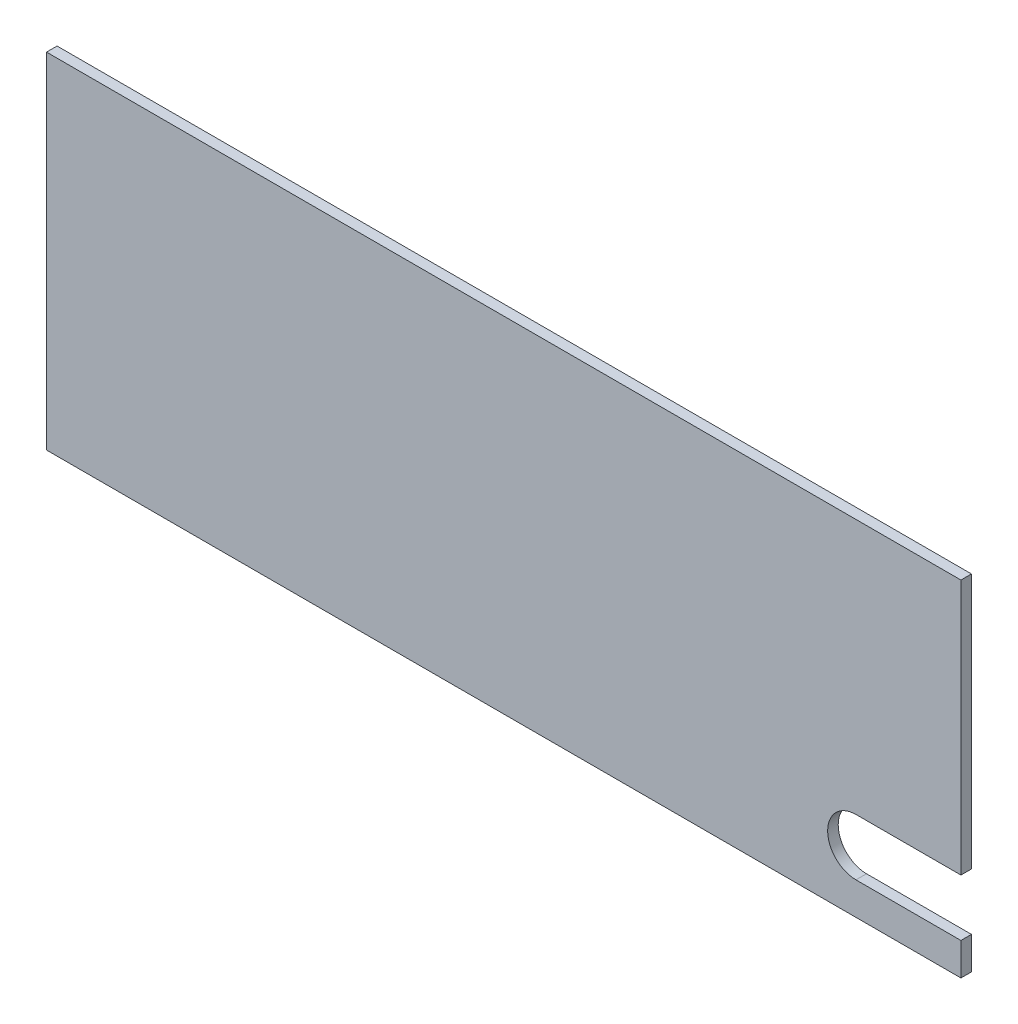
from build123d import *

# Parameters (mm, degrees)
SCHIZZO1_W                   = 130
SCHIZZO1_H                   = 49
ESTRUSIONE_ESTRUSIONE1_DEPTH = 1.5
TAGLIO_ESTRUSIONE1_DEPTH     = 12


with BuildPart() as part:
    # Schizzo1 → Estrusione-Estrusione1 (new body)
    with BuildSketch(Plane.XY):
        with Locations((65, 24.5)):
            Rectangle(SCHIZZO1_W, SCHIZZO1_H)
    extrude(amount=ESTRUSIONE_ESTRUSIONE1_DEPTH)

    # Schizzo2 → Taglio-Estrusione1 (cut)
    with BuildSketch(Plane.XY.offset(1.5)):
        with BuildLine():
            Line((144.922454277, 4.622930456), (115.077545723, 4.622930456))
            ThreePointArc((115.077545723, 4.622930456), (111.052124488, 8.64835169), (115.077545723, 12.673772925))
            Line((115.077545723, 12.673772925), (144.922454277, 12.673772925))
            ThreePointArc((144.922454277, 12.673772925), (148.947875512, 8.64835169), (144.922454277, 4.622930456))
        make_face()
    extrude(amount=-TAGLIO_ESTRUSIONE1_DEPTH, mode=Mode.SUBTRACT)


solid = part.part
